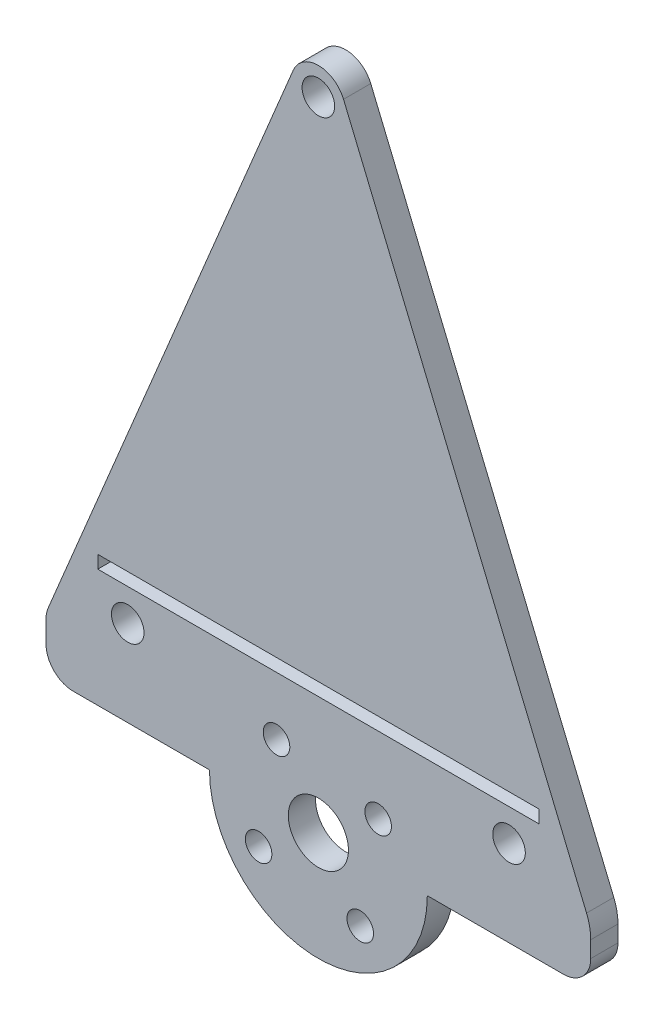
from build123d import *

# Parameters (mm, degrees)
BOSS_EXTRUDE1_DEPTH = 3.175
FILLET4_R           = 3.175
FILLET5_R           = 3.175
FILLET6_R           = 3.175
FILLET7_R           = 6.35
FILLET8_R           = 3.175
SKETCH2_R           = 3.5052
SKETCH2_R_2         = 1.5494
CUT_EXTRUDE1_DEPTH  = 78.949968089
SKETCH4_W           = 51.435
SKETCH4_H           = 1.5
CUT_EXTRUDE2_DEPTH  = 78.949968089
SKETCH10_R          = 1.89865
CUT_EXTRUDE3_DEPTH  = 78.949968089
SKETCH11_R          = 1.89865
CUT_EXTRUDE4_DEPTH  = 78.949968089


with BuildPart() as part:
    # Sketch1 → Boss-Extrude1 (new body)
    with BuildSketch(Plane.XY):
        with BuildLine():
            Line((-31.75, 0), (-31.75, -6.35))
            Line((-31.75, -6.35), (-12.7, -6.35))
            ThreePointArc((-12.7, -6.35), (0, -19.05), (12.7, -6.35))
            Line((12.7, -6.35), (31.75, -6.35))
            Line((31.75, -6.35), (31.75, 0))
            Line((31.75, 0), (0, 76.2))
            Line((0, 76.2), (-31.75, 0))
        make_face()
    extrude(amount=BOSS_EXTRUDE1_DEPTH)

    # Fillet4
    fillet4_edges = [part.edges().sort_by_distance(p)[0] for p in [
        (-31.75, -6.35, 1.5875),
    ]]
    fillet(fillet4_edges, radius=FILLET4_R)

    # Fillet5
    fillet5_edges = [part.edges().sort_by_distance(p)[0] for p in [
        (-31.75, 0, 1.5875),
    ]]
    fillet(fillet5_edges, radius=FILLET5_R)

    # Fillet6
    fillet6_edges = [part.edges().sort_by_distance(p)[0] for p in [
        (0, 76.2, 1.5875),
    ]]
    fillet(fillet6_edges, radius=FILLET6_R)

    # Fillet7
    fillet7_edges = [part.edges().sort_by_distance(p)[0] for p in [
        (31.75, 0, 1.5875),
    ]]
    fillet(fillet7_edges, radius=FILLET7_R)

    # Fillet8
    fillet8_edges = [part.edges().sort_by_distance(p)[0] for p in [
        (31.75, -6.35, 1.5875),
    ]]
    fillet(fillet8_edges, radius=FILLET8_R)

    # Sketch2 → Cut-Extrude1 (cut, through all)
    with BuildSketch(Plane.XY.offset(3.175)):
        with Locations((0, -6.35)):
            Circle(SKETCH2_R)
        with Locations((-4.880561897, 0.620164745)):
            Circle(SKETCH2_R_2)
        with Locations((4.880561897, -13.320164745)):
            Circle(SKETCH2_R_2)
        with Locations((6.970164745, -1.469438103)):
            Circle(SKETCH2_R_2)
        with Locations((-6.970164745, -11.230561897)):
            Circle(SKETCH2_R_2)
    extrude(amount=-CUT_EXTRUDE1_DEPTH, mode=Mode.SUBTRACT)

    # Sketch4 → Cut-Extrude2 (cut, through all)
    with BuildSketch(Plane.XY.offset(3.175)):
        with Locations((0, 8.154999946)):
            Rectangle(SKETCH4_W, SKETCH4_H)
    extrude(amount=-CUT_EXTRUDE2_DEPTH, mode=Mode.SUBTRACT)

    # Sketch10 → Cut-Extrude3 (cut, through all)
    with BuildSketch(Plane.XY.offset(3.175)):
        with Locations((-22.225, 3.678249946)):
            Circle(SKETCH10_R)
        with Locations((22.225, 3.678249946)):
            Circle(SKETCH10_R)
    extrude(amount=-CUT_EXTRUDE3_DEPTH, mode=Mode.SUBTRACT)

    # Sketch11 → Cut-Extrude4 (cut, through all)
    with BuildSketch(Plane.XY.offset(3.175)):
        with Locations((0, 67.945)):
            Circle(SKETCH11_R)
    extrude(amount=-CUT_EXTRUDE4_DEPTH, mode=Mode.SUBTRACT)


solid = part.part
